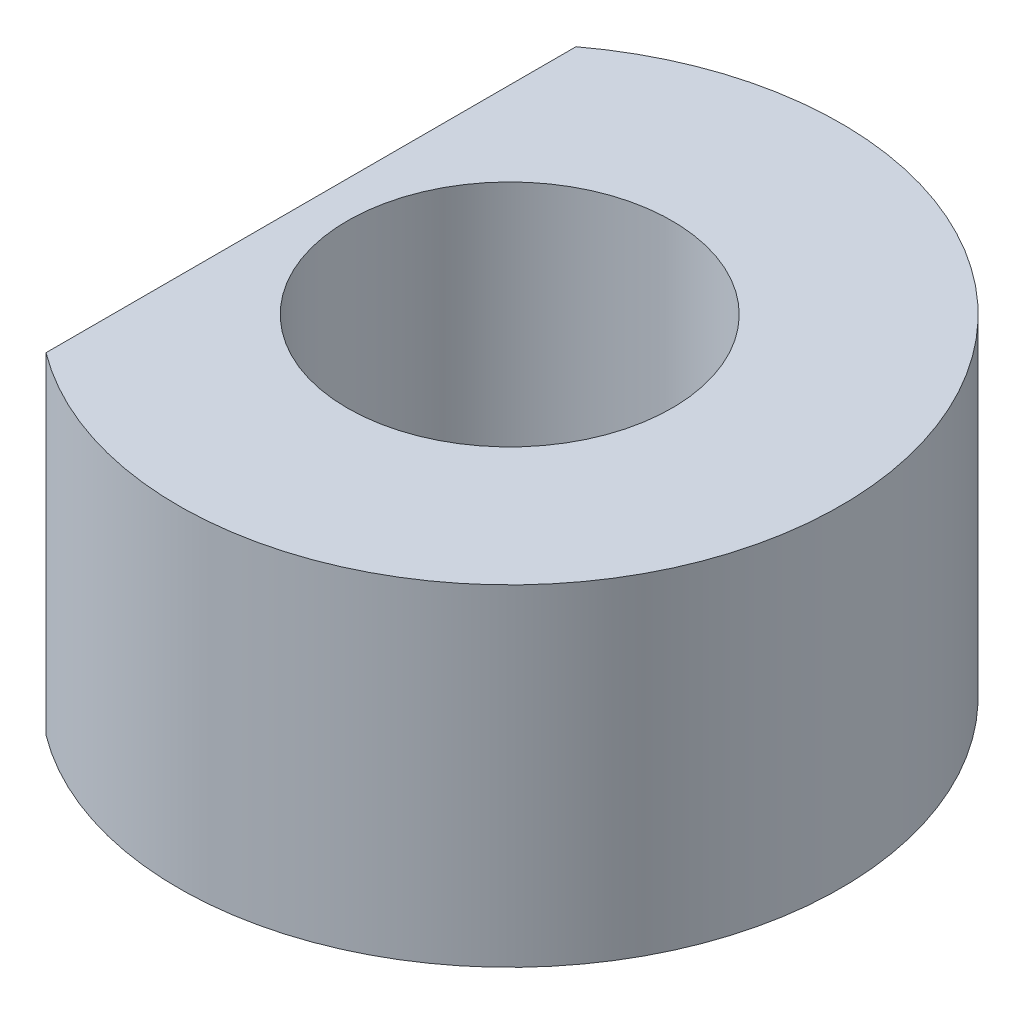
from build123d import *

# Parameters (mm, degrees)
BASE_FLANGE1_DEPTH = 5
SKETCH7_R          = 2.45
CUT_EXTRUDE1_DEPTH = 9.660254038


# Sheet-metal steps are written as plain solids
with BuildPart() as part:
    # Sketch1 → Base-Flange1 (new body)
    with BuildSketch(Plane(origin=(0, 0, 0), x_dir=(1, 0, 0), z_dir=(0, 1, 0))):
        with BuildLine():
            Line((-3, 4), (-3, -4))
            ThreePointArc((-3, -4), (5, 0), (-3, 4))
        make_face()
    extrude(amount=-BASE_FLANGE1_DEPTH)

    # Sketch7 → Cut-Extrude1 (cut, through all)
    with BuildSketch(Plane(origin=(0, 0, 0), x_dir=(1, 0, 0), z_dir=(0, 1, 0))):
        with Locations(Location((0, 0, 0), (0, 0, 270))):
            Circle(SKETCH7_R)
    extrude(amount=-CUT_EXTRUDE1_DEPTH, mode=Mode.SUBTRACT)


solid = part.part
